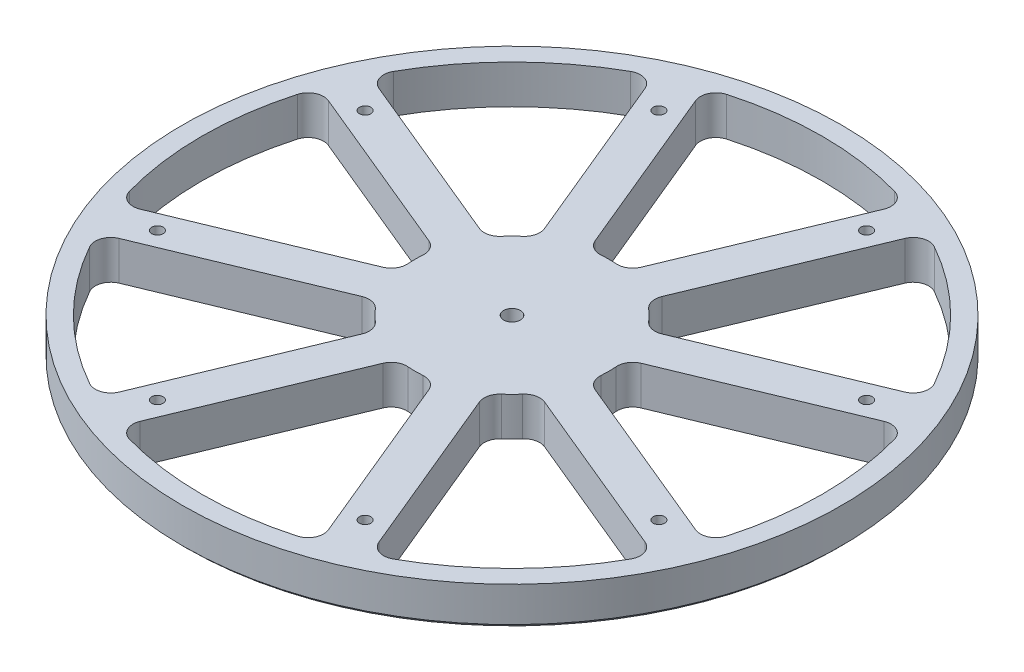
from build123d import *

# Parameters (mm, degrees)
SKETCH2_W                    = 84.99983
SKETCH2_H                    = 10
F_32_0_116_DIAMETER_HOLE1_D  = 2.9464
CIRPATTERN3_COUNT            = 8
CUT_EXTRUDE1_DEPTH           = 121.623141229
FILLET1_R                    = 4
CIRPATTERN4_COUNT            = 8
FILLET1_OF_CIRPATTERN4_R     = 4
CHAMFER2_SIZE                = 1
F_18_0_1695_DIAMETER_HOLE1_D = 4.3053


with BuildPart() as part:
    # Sketch2 → Revolve1 (revolve)
    with BuildSketch(Plane(origin=(0, 0, 0), x_dir=(0, 0, -1), z_dir=(1, 0, 0))):
        with Locations((-42.499915, 5)):
            Rectangle(SKETCH2_W, SKETCH2_H)
    revolve(axis=Axis((0, -0.75, 0), (0, 1, 0)))

    # #32 (0.116) Diameter Hole1 (through all)
    with Locations(Plane(origin=(0, 10, 0), x_dir=(1, 0, 0), z_dir=(0, 1, 0))):
        with Locations((-26.787840266, 64.671567276)):
            f_32_0_116_diameter_hole1 = Hole(F_32_0_116_DIAMETER_HOLE1_D / 2)

    # CirPattern3: #32 (0.116) Diameter Hole1 ×8 about axis
    cirpattern3_axis = Axis((0, -0.75, 0), (0, 1, 0))
    for i in range(1, CIRPATTERN3_COUNT):
        add(f_32_0_116_diameter_hole1.rotate(cirpattern3_axis, i * 360 / CIRPATTERN3_COUNT), mode=Mode.SUBTRACT)

    # Sketch8 → Cut-Extrude1 (cut, through all)
    with BuildSketch(Plane(origin=(0, 10, 0), x_dir=(1, 0, 0), z_dir=(0, 1, 0))):
        with BuildLine():
            Line((-4.754393761, 24.543751546), (-25.93535895, 75.67912497))
            ThreePointArc((-25.93535895, 75.67912497), (0, 79.99983), (25.93535895, 75.67912497))
            Line((25.93535895, 75.67912497), (4.754393761, 24.543751546))
            ThreePointArc((4.754393761, 24.543751546), (0, 25), (-4.754393761, 24.543751546))
        make_face()
    cut_extrude1 = extrude(amount=-CUT_EXTRUDE1_DEPTH, mode=Mode.SUBTRACT)

    # Fillet1
    fillet1_edges = [part.edges().sort_by_distance(p)[0] for p in [
        (4.754393761, 5, -24.543751546),
        (25.93535895, 5, -75.67912497),
        (-4.754393761, 5, -24.543751546),
        (-25.93535895, 5, -75.67912497),
    ]]
    fillet(fillet1_edges, radius=FILLET1_R)

    # CirPattern4: Cut-Extrude1 ×8 about axis
    cirpattern4_axis = Axis((0, -0.75, 0), (0, 1, 0))
    for i in range(1, CIRPATTERN4_COUNT):
        add(cut_extrude1.rotate(cirpattern4_axis, i * 360 / CIRPATTERN4_COUNT), mode=Mode.SUBTRACT)

    # Fillet1 of CirPattern4
    fillet1_of_cirpattern4_edges = [part.edges().sort_by_distance(p)[0] for p in [
        (-13.993189086, 5, -20.716917223),
        (-35.174154275, 5, -71.852290646),
        (-20.716917223, 5, -13.993189086),
        (-71.852290646, 5, -35.174154275),
        (-24.543751546, 5, -4.754393761),
        (-75.67912497, 5, -25.93535895),
        (-24.543751546, 5, 4.754393761),
        (-75.67912497, 5, 25.93535895),
        (-20.716917223, 5, 13.993189086),
        (-71.852290646, 5, 35.174154275),
        (-13.993189086, 5, 20.716917223),
        (-35.174154275, 5, 71.852290646),
        (-4.754393761, 5, 24.543751546),
        (-25.93535895, 5, 75.67912497),
        (4.754393761, 5, 24.543751546),
        (25.93535895, 5, 75.67912497),
        (13.993189086, 5, 20.716917223),
        (35.174154275, 5, 71.852290646),
        (20.716917223, 5, 13.993189086),
        (71.852290646, 5, 35.174154275),
        (24.543751546, 5, 4.754393761),
        (75.67912497, 5, 25.93535895),
        (24.543751546, 5, -4.754393761),
        (75.67912497, 5, -25.93535895),
        (20.716917223, 5, -13.993189086),
        (71.852290646, 5, -35.174154275),
        (13.993189086, 5, -20.716917223),
        (35.174154275, 5, -71.852290646),
    ]]
    fillet(fillet1_of_cirpattern4_edges, radius=FILLET1_OF_CIRPATTERN4_R)

    # Chamfer2
    chamfer2_edges = [part.edges().sort_by_distance(p)[0] for p in [
        (0, 0, -84.99983),
    ]]
    chamfer(chamfer2_edges, length=CHAMFER2_SIZE)

    # #18 (0.1695) Diameter Hole1 (through all)
    with Locations(Plane(origin=(0, 0, 0), x_dir=(-1, 0, 0), z_dir=(0, -1, 0))):
        with Locations((0, 0)):
            Hole(F_18_0_1695_DIAMETER_HOLE1_D / 2)


solid = part.part
